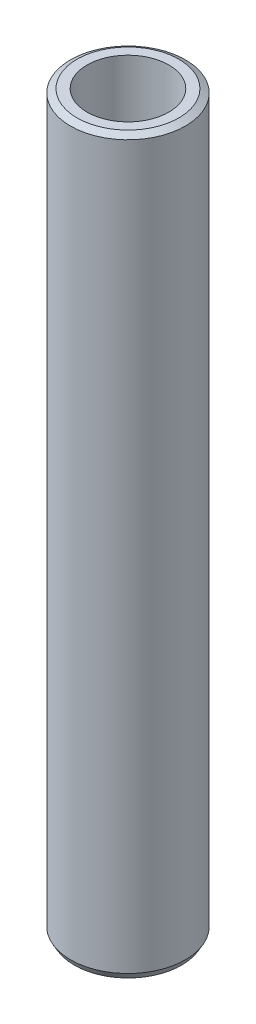
from build123d import *
from OCP.BRepFilletAPI import BRepFilletAPI_MakeChamfer

# Parameters (mm, degrees)
SKETCH1_R           = 45
BOSS_EXTRUDE1_DEPTH = 573.610338451
SKETCH2_R           = 32.034949784
CUT_EXTRUDE1_DEPTH  = 578.129812415
CHAMFER1_SIZE       = 2.961718714
CHAMFER1_SIZE2      = 5.129847291


with BuildPart() as part:
    # Sketch1 → Boss-Extrude1 (new body)
    with BuildSketch(Plane(origin=(0, 0, 0), x_dir=(1, 0, 0), z_dir=(0, 1, 0))):
        Circle(SKETCH1_R)
    extrude(amount=BOSS_EXTRUDE1_DEPTH)

    # Sketch2 → Cut-Extrude1 (cut, through all)
    with BuildSketch(Plane(origin=(0, 0, 0), x_dir=(1, 0, 0), z_dir=(0, 1, 0))):
        Circle(SKETCH2_R)
    extrude(amount=CUT_EXTRUDE1_DEPTH, mode=Mode.SUBTRACT)

    # Chamfer1: one chamfer whose edges measure the first distance from different faces: ONE call of the kernel's chamfer builder (chamfer() names one face for all edges)
    chamfer1_edges_1 = [part.edges().sort_by_distance(p)[0] for p in [
        (-45, 573.610338451, 0),
    ]]
    chamfer1_side_1 = [part.faces().sort_by_distance(p)[0] for p in [
        (-45, 286.805169226, 0),
    ]]
    chamfer1_edges_2 = [part.edges().sort_by_distance(p)[0] for p in [
        (-45, 0, 0),
    ]]
    chamfer1_side_2 = [part.faces().sort_by_distance(p)[0] for p in [
        (-43.727207794, 0, 0),
    ]]
    chamfer1 = BRepFilletAPI_MakeChamfer(part.part.solid().wrapped)
    for e in chamfer1_edges_1:
        chamfer1.Add(CHAMFER1_SIZE, CHAMFER1_SIZE2, e.wrapped, chamfer1_side_1[0].wrapped)  # the first distance lies on this face
    for e in chamfer1_edges_2:
        chamfer1.Add(CHAMFER1_SIZE, CHAMFER1_SIZE2, e.wrapped, chamfer1_side_2[0].wrapped)  # the first distance lies on this face
    add(Compound.cast(chamfer1.Shape()), mode=Mode.REPLACE)


solid = part.part
